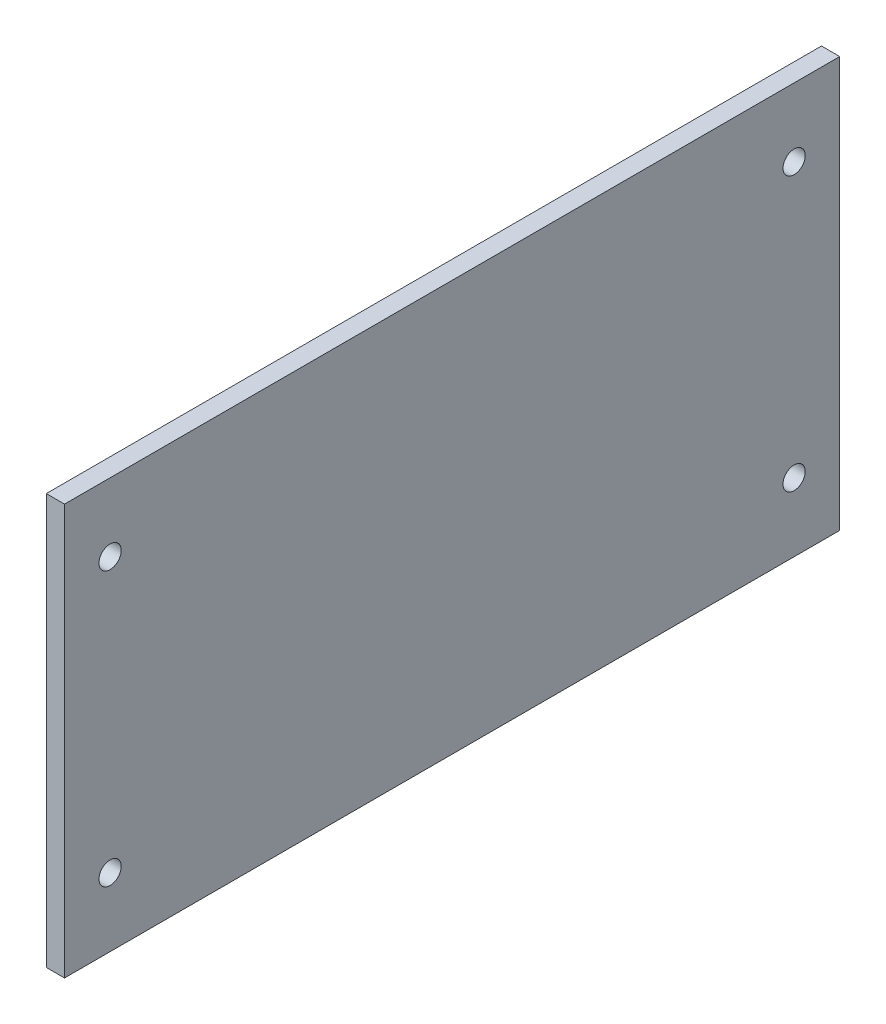
from build123d import *

# Parameters (mm, degrees)
SKETCH1_W                 = 85
SKETCH1_H                 = 45
BOSS_EXTRUDE1_DEPTH       = 2
F_2_CLEARANCE_HOLE1_D     = 2.4384
F_2_CLEARANCE_HOLE1_DEPTH = 3
F_2_CLEARANCE_HOLE1_TIP   = 0.732569267


with BuildPart() as part:
    # Sketch1 → Boss-Extrude1 (new body)
    with BuildSketch(Plane(origin=(0, 0, 0), x_dir=(0, 0, -1), z_dir=(1, 0, 0))):
        Rectangle(SKETCH1_W, SKETCH1_H)
    extrude(amount=BOSS_EXTRUDE1_DEPTH)

    # #2 Clearance Hole1
    with Locations(Plane(origin=(2, 0, 0), x_dir=(0, 0, -1), z_dir=(1, 0, 0))):
        with Locations((-37.5, 15), (-37.5, -15), (37.5, -15), (37.5, 15)):
            Hole(F_2_CLEARANCE_HOLE1_D / 2, depth=F_2_CLEARANCE_HOLE1_DEPTH)
            with Locations((0, 0, -(F_2_CLEARANCE_HOLE1_DEPTH + F_2_CLEARANCE_HOLE1_TIP / 2))):  # 118° drill point
                Cone(0, F_2_CLEARANCE_HOLE1_D / 2, F_2_CLEARANCE_HOLE1_TIP, mode=Mode.SUBTRACT)


solid = part.part
